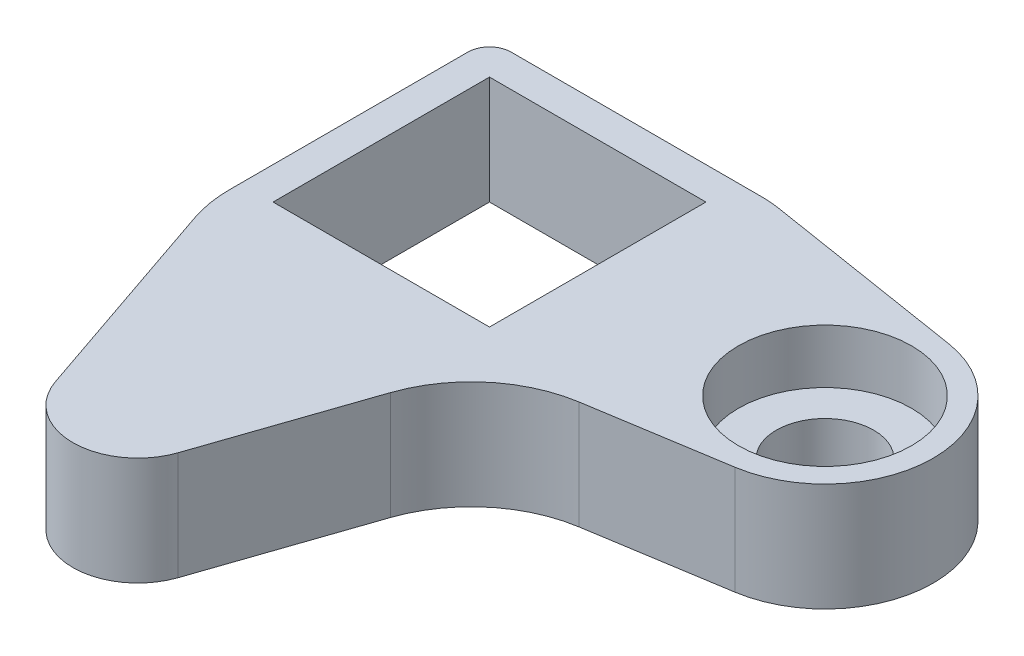
from build123d import *

# Parameters (mm, degrees)
SKETCH1_W           = 20
SKETCH1_H           = 20
BOSS_EXTRUDE1_DEPTH = 10
SKETCH2_R           = 8
CUT_EXTRUDE2_DEPTH  = 46
SKETCH3_R           = 4
SKETCH3_R_2         = 4.5
CUT_EXTRUDE3_DEPTH  = 10


with BuildPart() as part:
    # Sketch1 → Boss-Extrude1 (new body)
    with BuildSketch(Plane(origin=(0, 0, 0), x_dir=(1, 0, 0), z_dir=(0, 1, 0))):
        with BuildLine():
            Line((23.939871077, 2.849965846), (42.576368333, -0.125028462))
            ThreePointArc((42.576368333, -0.125028462), (51, -10), (42.576368333, -19.874971538))
            Line((42.576368333, -19.874971538), (30.130588759, -21.86172489))
            ThreePointArc((30.130588759, -21.86172489), (24.291669579, -24.533541475), (20.666245259, -29.833341429))
            Line((20.666245259, -29.833341429), (15.677992749, -44.439174654))
            ThreePointArc((15.677992749, -44.439174654), (10, -48.5), (4.322007251, -44.439174654))
            Line((4.322007251, -44.439174654), (-2.355985499, -24.885704137))
            ThreePointArc((-2.355985499, -24.885704137), (-2.837901545, -22.973082941), (-3, -21.00735483))
            Line((-3, -21.00735483), (-3, 1))
            ThreePointArc((-3, 1), (-2.414213562, 2.414213562), (-1, 3))
            Line((-1, 3), (22.048229077, 3))
            ThreePointArc((22.048229077, 3), (22.997020375, 2.962432657), (23.939871077, 2.849965846))
        make_face()
        with Locations((10, -10)):
            Rectangle(SKETCH1_W, SKETCH1_H, mode=Mode.SUBTRACT)
    extrude(amount=BOSS_EXTRUDE1_DEPTH)

    # Sketch2 → Cut-Extrude2 (cut)
    with BuildSketch(Plane(origin=(0, 5, 0), x_dir=(1, 0, 0), z_dir=(0, 1, 0))):
        with Locations((41, -10)):
            Circle(SKETCH2_R)
    extrude(amount=CUT_EXTRUDE2_DEPTH, mode=Mode.SUBTRACT)

    # Sketch3 → Cut-Extrude3 (cut)
    with BuildSketch(Plane(origin=(0, 5, 0), x_dir=(1, 0, 0), z_dir=(0, 1, 0))):
        with Locations((10, -42.5)):
            Circle(SKETCH3_R)
        with Locations((41, -10)):
            Circle(SKETCH3_R_2)
    extrude(amount=-CUT_EXTRUDE3_DEPTH, mode=Mode.SUBTRACT)


solid = part.part
